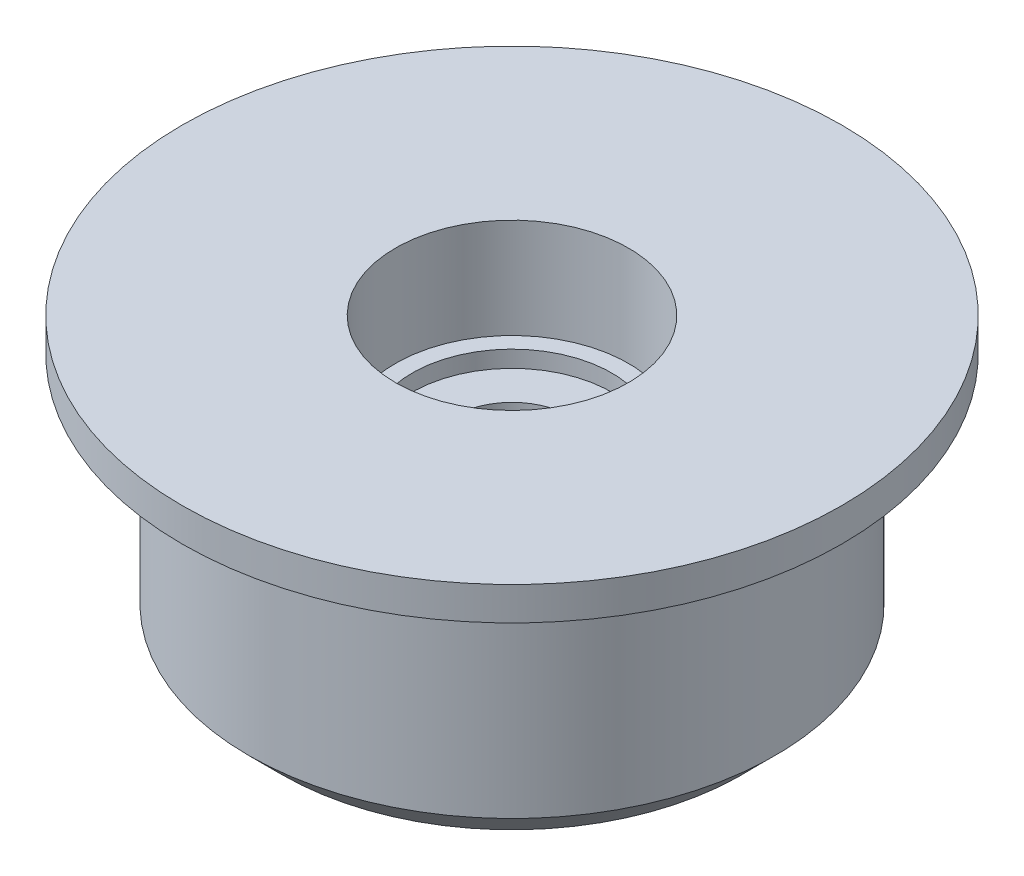
from build123d import *

# Parameters (mm, degrees)
CHAMFER1_SIZE = 1


with BuildPart() as part:
    # Sketch1 → Revolve1 (revolve)
    with BuildSketch(Plane.XY):
        Polygon((1.75, 0), (7.9, 0), (7.9, 7.5), (9.9, 7.5), (9.9, 8.5), (3.5, 8.5), (3.5, 5.5), (3, 5.5), (3, 5), (1.75, 5), align=None)
    revolve(axis=Axis((0, 37.275, 0), (0, -1, 0)))

    # Chamfer1
    chamfer1_edges = [part.edges().sort_by_distance(p)[0] for p in [
        (-7.9, 0, 0),
    ]]
    chamfer(chamfer1_edges, length=CHAMFER1_SIZE)


solid = part.part
